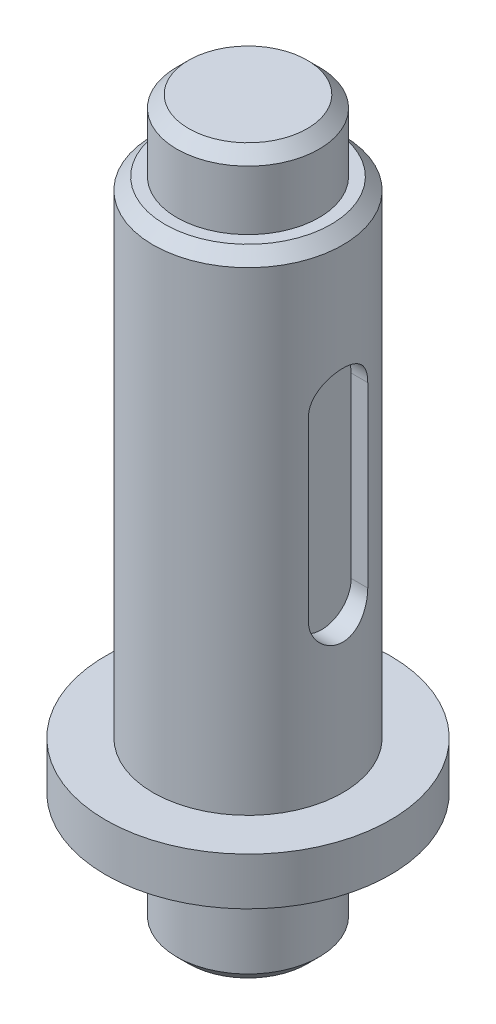
from build123d import *

# Parameters (mm, degrees)
SKETCH1_R           = 6
BOSS_EXTRUDE1_DEPTH = 10
SKETCH2_R           = 12
BOSS_EXTRUDE2_DEPTH = 4
SKETCH3_R           = 8
BOSS_EXTRUDE3_DEPTH = 41
SKETCH4_R           = 6
BOSS_EXTRUDE4_DEPTH = 6
CHAMFER1_SIZE       = 1
CHAMFER2_SIZE       = 1
CHAMFER3_SIZE       = 1
CUT_EXTRUDE1_DEPTH  = 1.8


with BuildPart() as part:
    # Sketch1 → Boss-Extrude1 (new body)
    with BuildSketch(Plane(origin=(0, 0, 0), x_dir=(1, 0, 0), z_dir=(0, 1, 0))):
        Circle(SKETCH1_R)
    extrude(amount=BOSS_EXTRUDE1_DEPTH)

    # Sketch2 → Boss-Extrude2 (add)
    with BuildSketch(Plane(origin=(0, 10, 0), x_dir=(1, 0, 0), z_dir=(0, 1, 0))):
        Circle(SKETCH2_R)
    extrude(amount=BOSS_EXTRUDE2_DEPTH)

    # Sketch3 → Boss-Extrude3 (add)
    with BuildSketch(Plane(origin=(0, 14, 0), x_dir=(1, 0, 0), z_dir=(0, 1, 0))):
        Circle(SKETCH3_R)
    extrude(amount=BOSS_EXTRUDE3_DEPTH)

    # Sketch4 → Boss-Extrude4 (add)
    with BuildSketch(Plane(origin=(0, 55, 0), x_dir=(1, 0, 0), z_dir=(0, 1, 0))):
        Circle(SKETCH4_R)
    extrude(amount=BOSS_EXTRUDE4_DEPTH)

    # Chamfer1
    chamfer1_edges = [part.edges().sort_by_distance(p)[0] for p in [
        (-6, 0, 0),
    ]]
    chamfer(chamfer1_edges, length=CHAMFER1_SIZE)

    # Chamfer2
    chamfer2_edges = [part.edges().sort_by_distance(p)[0] for p in [
        (-6, 61, 0),
    ]]
    chamfer(chamfer2_edges, length=CHAMFER2_SIZE)

    # Chamfer3
    chamfer3_edges = [part.edges().sort_by_distance(p)[0] for p in [
        (-8, 55, 0),
    ]]
    chamfer(chamfer3_edges, length=CHAMFER3_SIZE)

    # Sketch5 → Cut-Extrude1 (cut)
    with BuildSketch(Plane(origin=(8, 0, 0), x_dir=(0, 0, -1), z_dir=(1, 0, 0))):
        with BuildLine():
            Line((2.5, 42.5), (2.5, 27.5))
            ThreePointArc((2.5, 27.5), (0, 25), (-2.5, 27.5))
            Line((-2.5, 27.5), (-2.5, 42.5))
            ThreePointArc((-2.5, 42.5), (0, 45), (2.5, 42.5))
        make_face()
    extrude(amount=-CUT_EXTRUDE1_DEPTH, mode=Mode.SUBTRACT)


solid = part.part
